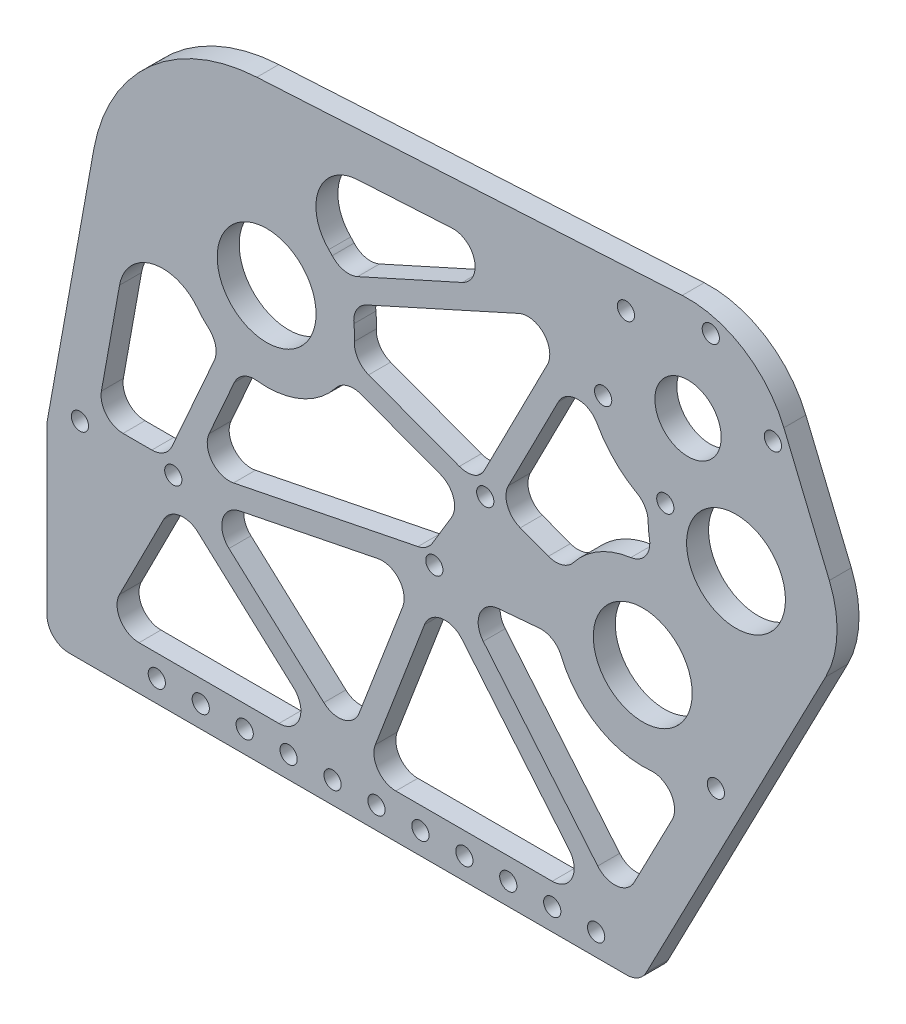
from build123d import *

# Parameters (mm, degrees)
BOSS_EXTRUDE1_DEPTH = 6.35
SKETCH8_R           = 2.4892
SKETCH8_R_2         = 9.5885
SKETCH8_R_3         = 14.2875
CUT_EXTRUDE1_DEPTH  = 423.140912796
FILLET2_R           = 6.35
CUT_EXTRUDE2_DEPTH  = 423.140912796
FILLET4_R           = 6.35


with BuildPart() as part:
    # Sketch6 → Boss-Extrude1 (new body)
    with BuildSketch(Plane.XY):
        with BuildLine():
            Line((88.9, 100.1522), (88.9, 154.686))
            Line((88.9, 154.686), (102.403069007, 229.723049032))
            ThreePointArc((102.403069007, 229.723049032), (118.739844017, 258.773784419), (149.565619556, 271.446866391))
            Line((149.565619556, 271.446866391), (272.538912647, 278.318852655))
            ThreePointArc((272.538912647, 278.318852655), (290.165667423, 273.771804863), (301.917522958, 259.869574141))
            Line((301.917522958, 259.869574141), (315.061287977, 228.208469575))
            ThreePointArc((315.061287977, 228.208469575), (317.267101924, 215.764974261), (314.010358834, 203.554330738))
            Line((314.010358834, 203.554330738), (260.35, 100.1522))
            Line((260.35, 100.1522), (88.9, 100.1522))
        make_face()
    extrude(amount=-BOSS_EXTRUDE1_DEPTH)

    # Sketch8 → Cut-Extrude1 (cut, through all)
    with BuildSketch(Plane.XY):
        with Locations((249.678098312, 241.794177305)):
            Circle(SKETCH8_R)
        with Locations((256.252102058, 266.328693293)):
            Circle(SKETCH8_R)
        with Locations((298.747130287, 254.942184796)):
            Circle(SKETCH8_R)
        with Locations((274.2126143, 248.368181051)):
            Circle(SKETCH8_R_2)
        with Locations((261.120439119, 180.086)):
            Circle(SKETCH8_R_3)
        with Locations((152.4, 220.726)):
            Circle(SKETCH8_R_3)
        with Locations((215.588385064, 199.44728721)):
            Circle(SKETCH8_R)
        with Locations((200.87775722, 174.949776042)):
            Circle(SKETCH8_R)
        with Locations((247.65, 106.5022)):
            Circle(SKETCH8_R)
        with Locations((234.95, 106.5022)):
            Circle(SKETCH8_R)
        with Locations((222.25, 106.5022)):
            Circle(SKETCH8_R)
        with Locations((209.55, 106.5022)):
            Circle(SKETCH8_R)
        with Locations((196.85, 106.5022)):
            Circle(SKETCH8_R)
        with Locations((184.15, 106.5022)):
            Circle(SKETCH8_R)
        with Locations((171.45, 106.5022)):
            Circle(SKETCH8_R)
        with Locations((158.75, 106.5022)):
            Circle(SKETCH8_R)
        with Locations((146.05, 106.5022)):
            Circle(SKETCH8_R)
        with Locations((133.35, 106.5022)):
            Circle(SKETCH8_R)
        with Locations((120.65, 106.5022)):
            Circle(SKETCH8_R)
        with Locations((98.425, 159.766)):
            Circle(SKETCH8_R)
        with Locations((125.4125, 159.766)):
            Circle(SKETCH8_R)
        with Locations((267.638610554, 223.833665063)):
            Circle(SKETCH8_R)
        with Locations((280.786618045, 272.902697038)):
            Circle(SKETCH8_R)
        with Locations((288.083603848, 217.00897588)):
            Circle(SKETCH8_R_3)
        with Locations((282.260358834, 159.766)):
            Circle(SKETCH8_R)
    extrude(amount=-CUT_EXTRUDE1_DEPTH, mode=Mode.SUBTRACT)

    # Fillet2
    fillet2_edges = [part.edges().sort_by_distance(p)[0] for p in [
        (88.9, 100.1522, -3.175),
        (88.9, 154.686, -3.175),
        (260.35, 100.1522, -3.175),
    ]]
    fillet(fillet2_edges, radius=FILLET2_R)

    # Sketch10 → Cut-Extrude2 (cut, through all)
    with BuildSketch(Plane.XY):
        with BuildLine():
            ThreePointArc((132.38135413, 205.092260283), (119.322526921, 209.603834109), (109.872798447, 199.524652682))
            Line((109.872798447, 199.524652682), (103.289496024, 162.941))
            Line((103.289496024, 162.941), (123.345875833, 162.941))
            Line((123.345875833, 162.941), (139.295192153, 198.967690982))
            ThreePointArc((139.295192153, 198.967690982), (135.557542228, 201.713067133), (132.38135413, 205.092260283))
        make_face()
        with BuildLine():
            Line((239.978176313, 263.779481252), (178.628040949, 260.35111663))
            ThreePointArc((178.628040949, 260.35111663), (167.47195221, 252.200720904), (170.357757373, 238.689266688))
            ThreePointArc((170.357757373, 238.689266688), (172.346517501, 236.451661817), (174.058196694, 233.995608734))
            Line((174.058196694, 233.995608734), (239.978176313, 263.779481252))
        make_face()
        with BuildLine():
            ThreePointArc((174.893810536, 208.928182933), (162.247952366, 197.312802136), (145.101630643, 196.397132276))
            Line((145.101630643, 196.397132276), (130.798217617, 164.08824638))
            Line((130.798217617, 164.08824638), (198.877387124, 177.785925299))
            Line((198.877387124, 177.785925299), (209.75334836, 195.89759155))
            Line((209.75334836, 195.89759155), (174.893810536, 208.928182933))
        make_face()
        with BuildLine():
            Line((241.81663743, 257.642066667), (176.672760989, 228.208851995))
            ThreePointArc((176.672760989, 228.208851995), (177.785899525, 221.572230052), (177.117199892, 214.876211158))
            Line((177.117199892, 214.876211158), (211.56702527, 201.998771417))
            ThreePointArc((211.56702527, 201.998771417), (212.778851211, 203.29279443), (214.380001095, 204.053936148))
            Line((214.380001095, 204.053936148), (241.81663743, 257.642066667))
        make_face()
        with BuildLine():
            ThreePointArc((262.934686924, 220.57155606), (249.32436933, 231.622457146), (244.215224783, 248.393259208))
            Line((244.215224783, 248.393259208), (219.032834611, 199.208031295))
            Line((219.032834611, 199.208031295), (238.626628583, 191.883817067))
            ThreePointArc((238.626628583, 191.883817067), (249.98056388, 202.912808355), (265.660714786, 205.076916287))
            ThreePointArc((265.660714786, 205.076916287), (263.067805907, 212.607856319), (262.934686924, 220.57155606))
        make_face()
        Polygon((172.391274942, 112.8522), (126.360421812, 154.618703891), (105.160585646, 112.8522), align=None)
        Polygon((195.852068159, 170.6999682), (132.201317489, 157.89329691), (175.810504033, 118.324113728), align=None)
        Polygon((201.907074815, 168.755620076), (180.515691522, 112.8522), (248.49923266, 112.8522), align=None)
        with BuildLine():
            ThreePointArc((277.409295847, 160.596691482), (252.8389143, 156.07399578), (236.280473193, 174.781653407))
            Line((236.280473193, 174.781653407), (207.216268027, 172.303671647))
            Line((207.216268027, 172.303671647), (254.218372429, 115.908378783))
            Line((254.218372429, 115.908378783), (277.409295847, 160.596691482))
        make_face()
    extrude(amount=-CUT_EXTRUDE2_DEPTH, mode=Mode.SUBTRACT)

    # Fillet4
    # the kernel refuses this fillet: 6.35 mm, written as the material it adds along each edge
    with BuildSketch(Plane(origin=(248.49923266, 112.8522, 0), x_dir=(-1, 0, 0), z_dir=(0, 0, -1))) as fillet4_piece_1:
        with BuildLine():
            CenterArc((FILLET4_R * 2.13521690322, FILLET4_R), FILLET4_R, 140.190815375, 129.809184625)
            Line((FILLET4_R * 1.36703600033, FILLET4_R * 1.6402328486), (0, 0))
            Line((0, 0), (FILLET4_R * 2.13521690322, 0))
        make_face()
    extrude(amount=6.35)
    with BuildSketch(Plane(origin=(180.515691522, 112.8522, 0), x_dir=(1, 0, 0), z_dir=(0, 0, -1))) as fillet4_piece_2:
        with BuildLine():
            CenterArc((FILLET4_R * 1.45335905573, -FILLET4_R), FILLET4_R, 90, 110.939295612)
            Line((FILLET4_R * 0.519399465515, -FILLET4_R * 1.35737862813), (0, 0))
            Line((0, 0), (FILLET4_R * 1.45335905573, 0))
        make_face()
    extrude(amount=6.35)
    with BuildSketch(Plane(origin=(201.907074815, 168.755620076, 0), x_dir=(-0.357378628128185, -0.9339595902164164, 0), z_dir=(0, 0, -1))) as fillet4_piece_3:
        with BuildLine():
            CenterArc((FILLET4_R * 1.70621582933, -FILLET4_R), FILLET4_R, 90, 119.251519763)
            Line((FILLET4_R * 0.83373278318, -FILLET4_R * 1.48864438417), (0, 0))
            Line((0, 0), (FILLET4_R * 1.70621582933, 0))
        make_face()
    extrude(amount=6.35)
    with BuildSketch(Plane(origin=(174.893810536, 208.928182933, 0), x_dir=(0.9366973583653521, -0.3501400560224029, 0), z_dir=(0, 0, -1)), Plane(origin=(139.295192153, 198.967690982, 0), x_dir=(-0.4048123947171637, -0.9143997621846558, 0), z_dir=(0, 0, -1))) as fillet4_piece_4:
        with BuildLine():
            CenterArc((5.086788407, 6.35), FILLET4_R, 197.457603124, 72.542396876)
            ThreePointArc((-0.970725522, 4.445), (-0.385636331, 2.244278851), (0, 0))
            Line((0, 0), (5.086788407, 0))
        make_face()
    extrude(amount=6.35)
    with BuildSketch(Plane(origin=(209.75334836, 195.89759155, 0), x_dir=(-0.93669735836535, 0.3501400560224082, 0), z_dir=(0, 0, -1))) as fillet4_piece_5:
        with BuildLine():
            CenterArc((FILLET4_R * 1.20212849433, -FILLET4_R), FILLET4_R, 90, 100.488715343)
            Line((FILLET4_R * 0.218837713742, -FILLET4_R * 1.18204186555), (0, 0))
            Line((0, 0), (FILLET4_R * 1.20212849433, 0))
        make_face()
    extrude(amount=6.35)
    with BuildSketch(Plane(origin=(198.877387124, 177.785925299, 0), x_dir=(0.5148076235760114, 0.8573057276771336, 0), z_dir=(0, 0, -1))) as fillet4_piece_6:
        with BuildLine():
            CenterArc((FILLET4_R * 0.441461803934, -FILLET4_R), FILLET4_R, 90, 47.639253807)
            Line((-FILLET4_R * 0.297455333429, -FILLET4_R * 0.326203692418), (0, 0))
            Line((0, 0), (FILLET4_R * 0.441461803934, 0))
        make_face()
    extrude(amount=6.35)
    with BuildSketch(Plane(origin=(130.798217617, 164.08824638, 0), x_dir=(0.9803533700206324, 0.19724925827284906, 0), z_dir=(0, 0, -1))) as fillet4_piece_7:
        with BuildLine():
            CenterArc((FILLET4_R * 1.93148545136, -FILLET4_R), FILLET4_R, 90, 125.255520411)
            Line((FILLET4_R * 1.11489950755, -FILLET4_R * 1.57722387024), (0, 0))
            Line((0, 0), (FILLET4_R * 1.93148545136, 0))
        make_face()
    extrude(amount=6.35)
    with BuildSketch(Plane(origin=(145.101630643, 196.397132276, 0), x_dir=(-0.40481239471715436, -0.9143997621846599, 0), z_dir=(0, 0, -1)), Plane(origin=(177.117199892, 214.876211158, 0), x_dir=(0.9366973583653604, -0.35014005602238013, 0), z_dir=(0, 0, -1)), Plane(origin=(236.280473193, 174.781653407, 0), x_dir=(-0.9963851567026929, -0.08495068865259449, 0), z_dir=(0, 0, -1))) as fillet4_piece_8:
        with BuildLine():
            CenterArc((5.086788407, -6.35), FILLET4_R, 90, 72.542396876)
            ThreePointArc((-0.970725522, -4.445), (-0.385636331, -2.244278851), (0, 0))
            Line((0, 0), (5.086788407, 0))
        make_face()
    extrude(amount=6.35)
    with BuildSketch(Plane(origin=(239.978176313, 263.779481252, 0), x_dir=(-0.9984422517997382, -0.05579489063586382, 0), z_dir=(0, 0, -1))) as fillet4_piece_9:
        with BuildLine():
            CenterArc((FILLET4_R * 5.36523624806, -FILLET4_R), FILLET4_R, 90, 158.884135456)
            Line((FILLET4_R * 5.00498112961, -FILLET4_R * 1.93285382007), (0, 0))
            Line((0, 0), (FILLET4_R * 5.36523624806, 0))
        make_face()
    extrude(amount=6.35)
    with BuildSketch(Plane(origin=(174.058196694, 233.995608734, 0), x_dir=(-0.5966944028681971, 0.8024685598736973, 0), z_dir=(0, 0, -1))) as fillet4_piece_10:
        with BuildLine():
            CenterArc((5.118482099, 6.324480793), FILLET4_R, 192.319179453, 72.542396876)
            Line((-1.085304127, 4.96966108), (0, 0))
            ThreePointArc((0, 0), (2.274880933, 0.10207683), (4.549761866, 0))
        make_face()
    extrude(amount=6.35)
    with BuildSketch(Plane(origin=(176.672760989, 228.208851995, 0), x_dir=(0.2078290249018196, -0.9781651682657478, 0), z_dir=(0, 0, -1)), Plane(origin=(238.626628583, 191.883817067, 0), x_dir=(0.541929150053695, 0.8404241764264517, 0), z_dir=(0, 0, -1))) as fillet4_piece_11:
        with BuildLine():
            CenterArc((5.118482099, -6.324480793), FILLET4_R, 95.138423671, 72.542396876)
            Line((-1.085304127, -4.96966108), (0, 0))
            ThreePointArc((0, 0), (2.274880933, -0.10207683), (4.549761866, 0))
        make_face()
    extrude(amount=6.35)
    with BuildSketch(Plane(origin=(172.391274942, 112.8522, 0), x_dir=(-1, 0, 0), z_dir=(0, 0, -1))) as fillet4_piece_12:
        with BuildLine():
            CenterArc((FILLET4_R * 2.5902609689, FILLET4_R), FILLET4_R, 132.219308612, 137.780691388)
            Line((FILLET4_R * 1.91829076742, FILLET4_R * 1.74057818515), (0, 0))
            Line((0, 0), (FILLET4_R * 2.5902609689, 0))
        make_face()
    extrude(amount=6.35)
    with BuildSketch(Plane(origin=(105.160585646, 112.8522, 0), x_dir=(1, 0, 0), z_dir=(0, 0, -1))) as fillet4_piece_13:
        with BuildLine():
            CenterArc((FILLET4_R * 1.62902415722, -FILLET4_R), FILLET4_R, 90, 116.911431892)
            Line((FILLET4_R * 0.737316917022, -FILLET4_R * 1.45261263546), (0, 0))
            Line((0, 0), (FILLET4_R * 1.62902415722, 0))
        make_face()
    extrude(amount=6.35)
    with BuildSketch(Plane(origin=(126.360421812, 154.618703891, 0), x_dir=(-0.45261263545622027, -0.8917072402001538, 0), z_dir=(0, 0, -1))) as fillet4_piece_14:
        with BuildLine():
            CenterArc((FILLET4_R * 1.3105007302, -FILLET4_R), FILLET4_R, 90, 105.30787672)
            Line((FILLET4_R * 0.345979596726, -FILLET4_R * 1.26400564971), (0, 0))
            Line((0, 0), (FILLET4_R * 1.3105007302, 0))
        make_face()
    extrude(amount=6.35)
    with BuildSketch(Plane(origin=(265.660714786, 205.076916287, 0), x_dir=(-0.32502885090145955, 0.9457041007004657, 0), z_dir=(0, 0, -1))) as fillet4_piece_15:
        with BuildLine():
            CenterArc((8.991251597, -6.270920438), FILLET4_R, 99.0517934, 92.108960875)
            ThreePointArc((2.761342992, -7.500041575), (1.677510036, -3.640731657), (0, 0))
            ThreePointArc((0, 0), (3.996111821, -0.316318246), (7.992223642, 0))
        make_face()
    extrude(amount=6.35)
    with BuildSketch(Plane(origin=(219.032834611, 199.208031295, 0), x_dir=(0.9366973583653502, -0.3501400560224078, 0), z_dir=(0, 0, -1))) as fillet4_piece_16:
        with BuildLine():
            CenterArc((FILLET4_R * 1.12269397046, -FILLET4_R), FILLET4_R, 90, 96.616152506)
            Line((FILLET4_R * 0.129353646771, -FILLET4_R * 1.11521719202), (0, 0))
            Line((0, 0), (FILLET4_R * 1.12269397046, 0))
        make_face()
    extrude(amount=6.35)
    with BuildSketch(Plane(origin=(244.215224783, 248.393259208, 0), x_dir=(-0.45573187598644843, -0.8901171030880557, 0), z_dir=(0, 0, -1))) as fillet4_piece_17:
        with BuildLine():
            CenterArc((16.459648826, -6.35), FILLET4_R, 90, 124.071161903)
            ThreePointArc((11.19967452, -9.907410617), (6.227056688, -4.244675096), (0, 0))
            Line((0, 0), (16.459648826, 0))
        make_face()
    extrude(amount=6.35)
    with BuildSketch(Plane(origin=(262.934686924, 220.57155606, 0), x_dir=(-0.06578459951306488, -0.9978338471243124, 0), z_dir=(0, 0, -1))) as fillet4_piece_18:
        with BuildLine():
            CenterArc((4.276016233, 6.332200859), FILLET4_R, 205.690778373, 60.018288102)
            ThreePointArc((-1.446265986, 3.579386625), (-0.665491896, 1.812983436), (0, 0))
            ThreePointArc((0, 0), (1.900451659, 0.071196564), (3.800903318, 0))
        make_face()
    extrude(amount=6.35)
    with BuildSketch(Plane(origin=(123.345875833, 162.941, 0), x_dir=(0.40481239471716945, 0.9143997621846535, 0), z_dir=(0, 0, -1))) as fillet4_piece_19:
        with BuildLine():
            CenterArc((FILLET4_R * 0.650905249429, -FILLET4_R), FILLET4_R, 90, 66.120628636)
            Line((-FILLET4_R * 0.263494512755, -FILLET4_R * 0.595187605283), (0, 0))
            Line((0, 0), (FILLET4_R * 0.650905249429, 0))
        make_face()
    extrude(amount=6.35)
    with BuildSketch(Plane(origin=(103.289496024, 162.941, 0), x_dir=(1, 0, 0), z_dir=(0, 0, -1))) as fillet4_piece_20:
        with BuildLine():
            CenterArc((FILLET4_R * 1.19601439217, -FILLET4_R), FILLET4_R, 90, 100.201311261)
            Line((FILLET4_R * 0.211822837185, -FILLET4_R * 1.1771072644), (0, 0))
            Line((0, 0), (FILLET4_R * 1.19601439217, 0))
        make_face()
    extrude(amount=6.35)
    with BuildSketch(Plane(origin=(195.852068159, 170.6999682, 0), x_dir=(-0.3573786281281809, -0.9339595902164181, 0), z_dir=(0, 0, -1))) as fillet4_piece_21:
        with BuildLine():
            CenterArc((FILLET4_R * 1.8158181583, FILLET4_R), FILLET4_R, 147.684555341, 122.315444659)
            Line((FILLET4_R * 0.970700395887, FILLET4_R * 1.53458017889), (0, 0))
            Line((0, 0), (FILLET4_R * 1.8158181583, 0))
        make_face()
    extrude(amount=6.35)
    with BuildSketch(Plane(origin=(175.810504033, 118.324113728, 0), x_dir=(0.35737862812818266, 0.9339595902164173, 0), z_dir=(0, 0, -1))) as fillet4_piece_22:
        with BuildLine():
            CenterArc((FILLET4_R * 1.46265296801, -FILLET4_R), FILLET4_R, 90, 111.280013)
            Line((FILLET4_R * 0.530835080934, -FILLET4_R * 1.36292619818), (0, 0))
            Line((0, 0), (FILLET4_R * 1.46265296801, 0))
        make_face()
    extrude(amount=6.35)
    with BuildSketch(Plane(origin=(132.201317489, 157.89329691, 0), x_dir=(0.7405781851536982, -0.6719702014780528, 0), z_dir=(0, 0, -1))) as fillet4_piece_23:
        with BuildLine():
            CenterArc((FILLET4_R * 1.97985852234, -FILLET4_R), FILLET4_R, 90, 126.404542341)
            Line((FILLET4_R * 1.17501177306, -FILLET4_R * 1.59348269576), (0, 0))
            Line((0, 0), (FILLET4_R * 1.97985852234, 0))
        make_face()
    extrude(amount=6.35)
    with BuildSketch(Plane(origin=(277.409295847, 160.596691482, 0), x_dir=(-0.4606177727337913, -0.8875985958989354, 0), z_dir=(0, 0, -1))) as fillet4_piece_24:
        with BuildLine():
            CenterArc((16.965462145, 6.35), FILLET4_R, 147.444724208, 122.555275792)
            ThreePointArc((11.613220522, 9.767017648), (6.553020907, 3.99600849), (0, 0))
            Line((0, 0), (16.965462145, 0))
        make_face()
    extrude(amount=6.35)
    with BuildSketch(Plane(origin=(254.218372429, 115.908378783, 0), x_dir=(0.4606177727337955, 0.8875985958989331, 0), z_dir=(0, 0, -1))) as fillet4_piece_25:
        with BuildLine():
            CenterArc((FILLET4_R * 1.50409098811, -FILLET4_R), FILLET4_R, 90, 112.763836941)
            Line((FILLET4_R * 0.581983434092, -FILLET4_R * 1.38693366206), (0, 0))
            Line((0, 0), (FILLET4_R * 1.50409098811, 0))
        make_face()
    extrude(amount=6.35)
    with BuildSketch(Plane(origin=(207.216268027, 172.303671647, 0), x_dir=(0.6402328485983261, -0.7681809028970148, 0), z_dir=(0, 0, -1))) as fillet4_piece_26:
        with BuildLine():
            CenterArc((FILLET4_R * 1.9183652575, -FILLET4_R), FILLET4_R, 90, 124.935995343)
            Line((FILLET4_R * 1.0985729868, -FILLET4_R * 1.57266101047), (0, 0))
            Line((0, 0), (FILLET4_R * 1.9183652575, 0))
        make_face()
    extrude(amount=6.35)
    with BuildSketch(Plane(origin=(241.81663743, 257.642066667, 0), x_dir=(-0.9113002737803683, -0.4117424085612579, 0), z_dir=(0, 0, -1))) as fillet4_piece_27:
        with BuildLine():
            CenterArc((FILLET4_R * 2.8576598332, -FILLET4_R), FILLET4_R, 90, 141.426371583)
            Line((FILLET4_R * 2.23414001373, -FILLET4_R * 1.78180754328), (0, 0))
            Line((0, 0), (FILLET4_R * 2.8576598332, 0))
        make_face()
    extrude(amount=6.35)
    with BuildSketch(Plane(origin=(211.56702527, 201.998771417, 0), x_dir=(0.7323899755840605, 0.6808853968649786, 0), z_dir=(0, 0, -1))) as fillet4_piece_28:
        with BuildLine():
            CenterArc((4.02645088, -6.142355487), FILLET4_R, 104.692699836, 48.716051847)
            Line((-1.651862755, -3.299952584), (0, 0))
            ThreePointArc((0, 0), (1.207935264, -0.155733385), (2.415870528, 0))
        make_face()
    extrude(amount=6.35)
    with BuildSketch(Plane(origin=(214.380001095, 204.053936148, 0), x_dir=(-0.9185032326241558, -0.3954134692432415, 0), z_dir=(0, 0, -1))) as fillet4_piece_29:
        with BuildLine():
            CenterArc((2.372088188, 6.278710984), FILLET4_R, 230.403797881, 31.002719134)
            Line((-1.675229819, 1.385683603), (0, 0))
            ThreePointArc((0, 0), (0.711626456, 0.053466762), (1.423252913, 0))
        make_face()
    extrude(amount=6.35)


solid = part.part
